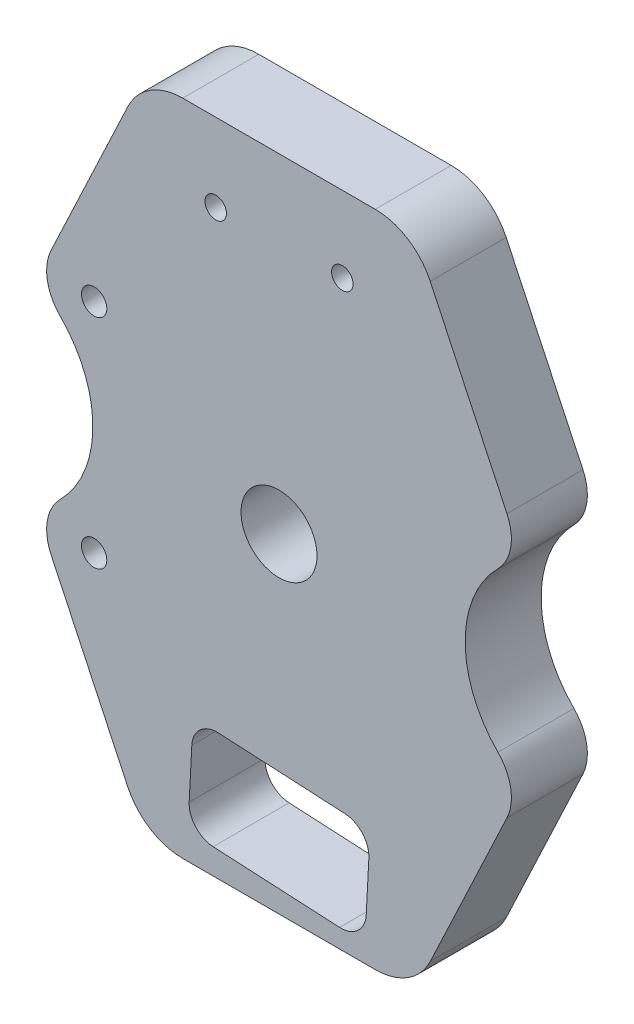
from build123d import *

# Parameters (mm, degrees)
SZKIC1_R                    = 15
SZKIC1_R_2                  = 5
SZKIC1_R_3                  = 4.25
DODANIE_WYCI_GNI_CIE1_DEPTH = 30
WYTNIJ_WYCI_GNI_CIE1_DEPTH  = 30
ZAOKR_GLENIE1_R             = 10


with BuildPart() as part:
    # Szkic1 → Dodanie-wyciągnięcie1 (new body)
    with BuildSketch(Plane.XY):
        with BuildLine():
            Line((-38, 260), (38, 260))
            ThreePointArc((38, 260), (50.853486978, 256.267902519), (59.709435091, 246.232322709))
            Line((59.709435091, 246.232322709), (90.008216267, 181.948831851))
            ThreePointArc((90.008216267, 181.948831851), (91.483769879, 171.062118236), (86.44222441, 161.300939461))
            ThreePointArc((86.44222441, 161.300939461), (73.499977081, 129.92645546), (86.44222441, 98.551971459))
            ThreePointArc((86.44222441, 98.551971459), (91.483769879, 88.790792684), (90.008216267, 77.904079069))
            Line((90.008216267, 77.904079069), (59.766160901, 13.740940677))
            ThreePointArc((59.766160901, 13.740940677), (50.88106069, 3.705595357), (38, 0))
            Line((38, 0), (0, 0))
            Line((0, 0), (-38, 0))
            ThreePointArc((-38, 0), (-50.88106069, 3.705595357), (-59.766160901, 13.740940677))
            Line((-59.766160901, 13.740940677), (-90.008216267, 77.904079069))
            ThreePointArc((-90.008216267, 77.904079069), (-91.483769879, 88.790792684), (-86.44222441, 98.551971459))
            ThreePointArc((-86.44222441, 98.551971459), (-73.499977081, 129.92645546), (-86.44222441, 161.300939461))
            ThreePointArc((-86.44222441, 161.300939461), (-91.483769879, 171.062118236), (-90.008216267, 181.948831851))
            Line((-90.008216267, 181.948831851), (-59.709435091, 246.232322709))
            ThreePointArc((-59.709435091, 246.232322709), (-50.853486978, 256.267902519), (-38, 260))
        make_face()
        with Locations((0, 130)):
            Circle(SZKIC1_R, mode=Mode.SUBTRACT)
        with Locations((-73, 87)):
            Circle(SZKIC1_R_2, mode=Mode.SUBTRACT)
        with Locations((-73, 173)):
            Circle(SZKIC1_R_2, mode=Mode.SUBTRACT)
        with Locations((25, 230)):
            Circle(SZKIC1_R_3, mode=Mode.SUBTRACT)
        with Locations((-24.992384758, 229.127379678)):
            Circle(SZKIC1_R_3, mode=Mode.SUBTRACT)
        with Locations((-25, 30)):
            Circle(SZKIC1_R_3, mode=Mode.SUBTRACT)
        with Locations((24.931476738, 27.383202188)):
            Circle(SZKIC1_R_3, mode=Mode.SUBTRACT)
    extrude(amount=DODANIE_WYCI_GNI_CIE1_DEPTH)

    # Szkic4 → Wytnij-wyciągnięcie1 (cut)
    with BuildSketch(Plane(origin=(-86.44222441, 98.551971459, 0), x_dir=(-1, 0, 0), z_dir=(0, 0, -1))):
        Polygon((-52.536909819, -48.057816777), (-50.443471569, -88.002998167), (-120.347539002, -91.666515104), (-122.440977251, -51.721333714), align=None)
    extrude(amount=-WYTNIJ_WYCI_GNI_CIE1_DEPTH, mode=Mode.SUBTRACT)

    # Zaokrąglenie1
    zaokr_glenie1_edges = [part.edges().sort_by_distance(p)[0] for p in [
        (33.905314592, 6.885456354, 15),
        (-35.998752841, 10.548973291, 15),
        (-33.905314592, 50.494154682, 15),
        (35.998752841, 46.830637745, 15),
    ]]
    fillet(zaokr_glenie1_edges, radius=ZAOKR_GLENIE1_R)


solid = part.part
